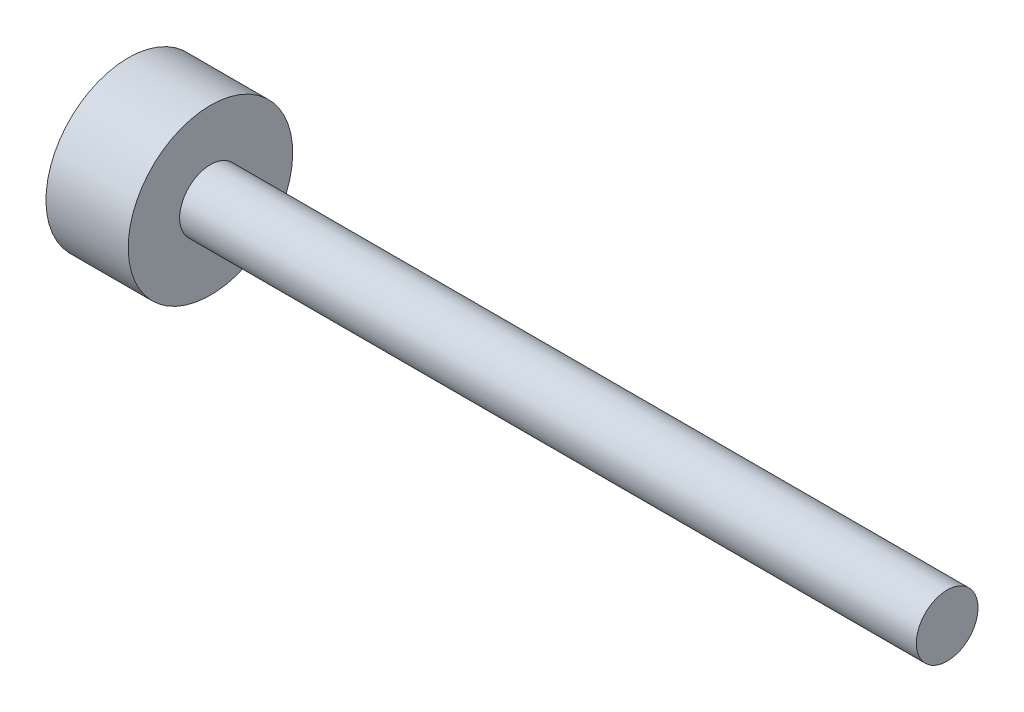
from build123d import *


with BuildPart() as part:
    # Sketch1 → Revolve1 (revolve)
    with BuildSketch(Plane.XY):
        Polygon((0, 0), (0, 0.75), (-17.914000002, 0.75), (-17.914000002, 2), (-19.914000002, 2), (-19.914000002, 0), align=None)
    revolve(axis=Axis((0, 0, 0), (-1, 0, 0)))


solid = part.part
